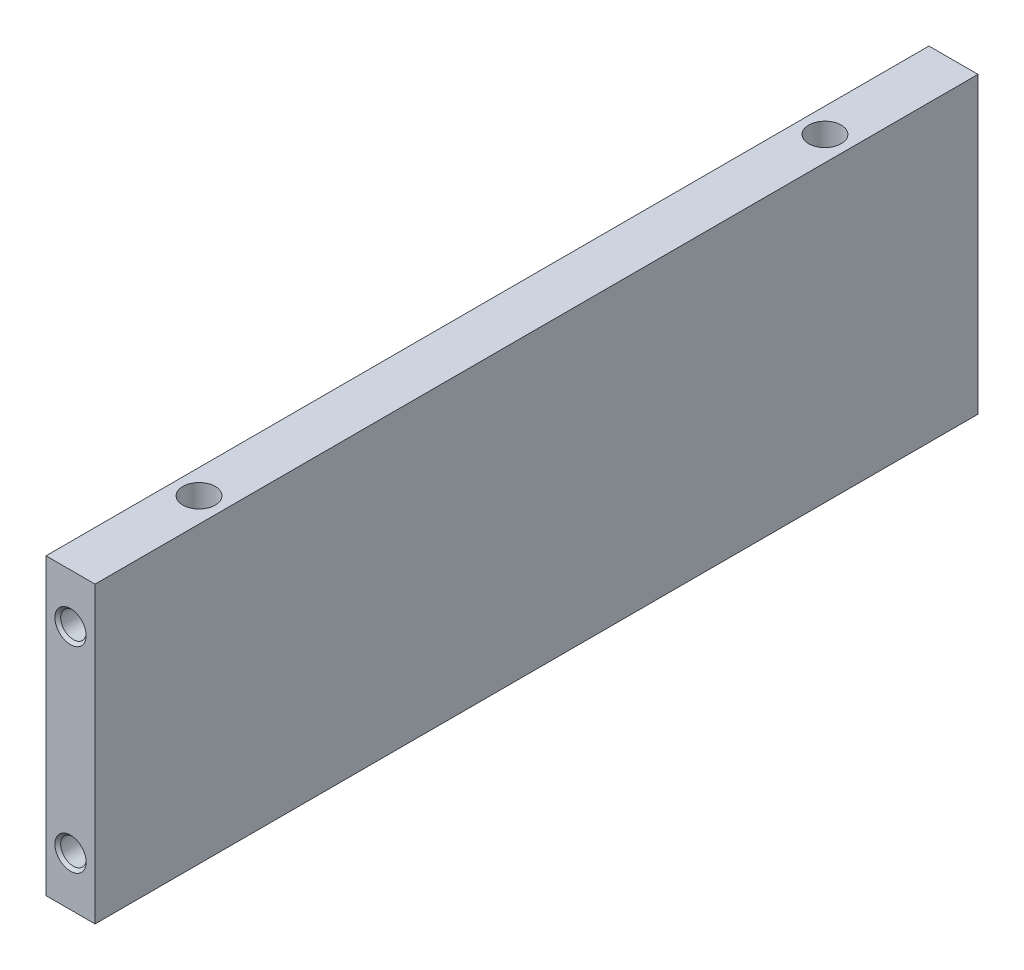
from build123d import *

# Parameters (mm, degrees)
BOSS_EXTRUDE1_DEPTH      = 57.15
BOSS_EXTRUDE1_DEPTH_BACK = 57.15
SKETCH1_W                = 6.35
SKETCH1_H                = 38.1
SKETCH2_R                = 2.1
CUT_EXTRUDE2_DEPTH       = 69.759094853


# Read off the part's stored shape, not the designer's step: Trou taraudé M4x0.71
with BuildPart() as part:
    # Sketch1 → Boss-Extrude1 (new, two sides: drawn at the far end of the back side and taken through both)
    with BuildSketch(Plane.XY.offset(-BOSS_EXTRUDE1_DEPTH_BACK)):
        Rectangle(SKETCH1_W, SKETCH1_H)
    extrude(amount=BOSS_EXTRUDE1_DEPTH + BOSS_EXTRUDE1_DEPTH_BACK)

    # Sketch2 → Cut-Extrude2 (cut, through all)
    with BuildSketch(Plane(origin=(0, 19.05, 0), x_dir=(1, 0, 0), z_dir=(0, 1, 0))):
        with Locations(Location((0, 40.513, 0), (0, 0, 270))):
            Circle(SKETCH2_R)
        with Locations(Location((0, -40.513, 0), (0, 0, 270))):
            Circle(SKETCH2_R)
    extrude(amount=-CUT_EXTRUDE2_DEPTH, mode=Mode.SUBTRACT)

    # Trou taraudé M4x0.71 outline → Trou taraudé M4x0.71 (revolve, cut)
    with BuildSketch(Plane.XZ.offset(12.7)):
        Polygon((0, 41.811742237), (1.65, 41.811742237), (1.65, 56.775), (2.025, 57.15), (0, 57.15), align=None)
    trou_taraud_m4x0_71 = revolve(axis=Axis((0, -12.7, 0), (0, 0, 1)), mode=Mode.SUBTRACT)

    # Trou taraud_ M4x0.71 2 outline → Trou taraud_ M4x0.71 2 (revolve, cut)
    with BuildSketch(Plane.XZ.offset(-12.7)):
        Polygon((0, 41.811742237), (1.65, 41.811742237), (1.65, 56.775), (2.025, 57.15), (0, 57.15), align=None)
    trou_taraud_m4x0_71_2 = revolve(axis=Axis((0, 12.7, 0), (0, 0, 1)), mode=Mode.SUBTRACT)

    # Symétrie1: Trou taraudé M4x0.71, Trou taraud_ M4x0.71 2 across plane
    add(trou_taraud_m4x0_71.mirror(Plane.XY), mode=Mode.SUBTRACT)
    add(trou_taraud_m4x0_71_2.mirror(Plane.XY), mode=Mode.SUBTRACT)


solid = part.part
